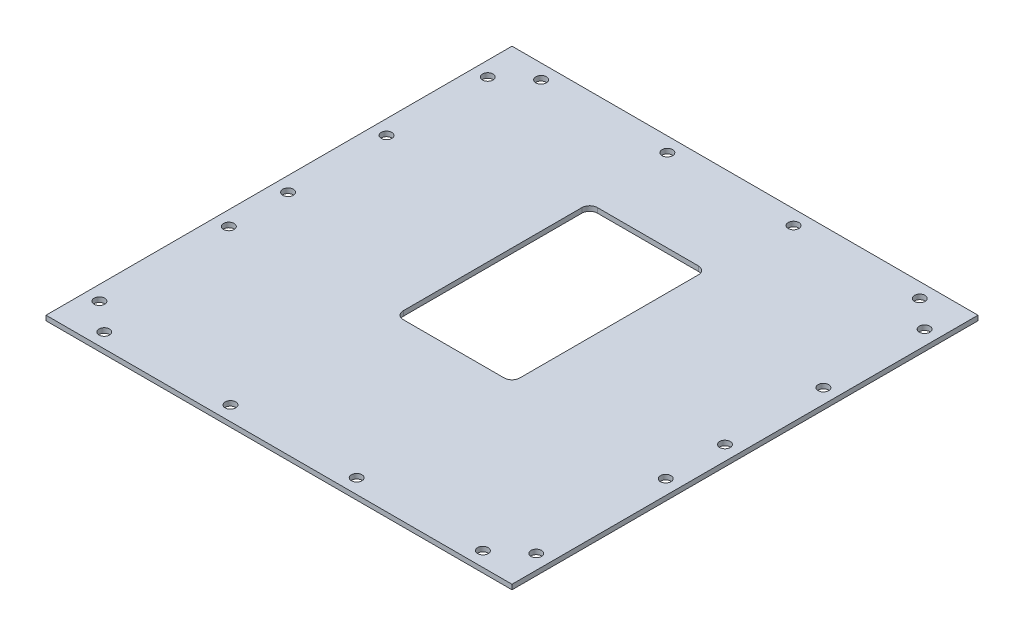
from build123d import *

# Parameters (mm, degrees)
SKETCH2_W                 = 152.4
SKETCH2_H                 = 152.4
BOSS_EXTRUDE1_DEPTH       = 1.5875
F_5_CLEARANCE_HOLE2_D     = 3.4544
F_5_CLEARANCE_HOLE3_D     = 3.4544
LPATTERN1_COUNT           = 4
LPATTERN1_PITCH           = 42.333333333
LPATTERN2_COUNT           = 4
LPATTERN2_PITCH           = 41.275
F_5_CLEARANCE_HOLE4_D     = 3.4544
F_5_CLEARANCE_HOLE4_DEPTH = 12.7
F_5_CLEARANCE_HOLE4_TIP   = 1.037806461
SKETCH12_W                = 38.1
SKETCH12_H                = 63.5
CUT_EXTRUDE1_DEPTH        = 2.54
FILLET2_R                 = 2.54


with BuildPart() as part:
    # Sketch2 → Boss-Extrude1 (new body)
    with BuildSketch(Plane(origin=(0, 0, 0), x_dir=(1, 0, 0), z_dir=(0, 1, 0))):
        with Locations((76.2, 76.2)):
            Rectangle(SKETCH2_W, SKETCH2_H)
    extrude(amount=BOSS_EXTRUDE1_DEPTH)

    # #5 Clearance Hole2 (through all)
    with Locations(Plane(origin=(0, 1.5875, 0), x_dir=(1, 0, 0), z_dir=(0, 1, 0))):
        with Locations((14.2875, 147.6375), (14.2875, 4.7625)):
            f_5_clearance_hole2 = Hole(F_5_CLEARANCE_HOLE2_D / 2)

    # #5 Clearance Hole3 (through all)
    with Locations(Plane(origin=(0, 1.5875, 0), x_dir=(1, 0, 0), z_dir=(0, 1, 0))):
        with Locations((4.7625, 139.7), (147.6375, 139.7)):
            f_5_clearance_hole3 = Hole(F_5_CLEARANCE_HOLE3_D / 2)

    # LPattern1: #5 Clearance Hole3 ×4, 1 skipped
    with Locations(*[(0, 0, i * LPATTERN1_PITCH) for i in range(1, LPATTERN1_COUNT) if i not in (1,)]):
        add(f_5_clearance_hole3, mode=Mode.SUBTRACT)

    # LPattern2: #5 Clearance Hole2 ×4
    with Locations(*[(i * LPATTERN2_PITCH, 0, 0) for i in range(1, LPATTERN2_COUNT)]):
        add(f_5_clearance_hole2, mode=Mode.SUBTRACT)

    # #5 Clearance Hole4
    with Locations(Plane(origin=(0, 1.5875, 0), x_dir=(1, 0, 0), z_dir=(0, 1, 0))):
        with Locations((147.6375, 106.61), (147.6375, 74.4), (4.7625, 74.4), (4.7625, 106.61)):
            Hole(F_5_CLEARANCE_HOLE4_D / 2, depth=F_5_CLEARANCE_HOLE4_DEPTH)
            with Locations((0, 0, -(F_5_CLEARANCE_HOLE4_DEPTH + F_5_CLEARANCE_HOLE4_TIP / 2))):  # 118° drill point
                Cone(0, F_5_CLEARANCE_HOLE4_D / 2, F_5_CLEARANCE_HOLE4_TIP, mode=Mode.SUBTRACT)

    # Sketch12 → Cut-Extrude1 (cut)
    with BuildSketch(Plane(origin=(0, 1.5875, 0), x_dir=(1, 0, 0), z_dir=(0, 1, 0))):
        with Locations((76.2, 88.9)):
            Rectangle(SKETCH12_W, SKETCH12_H)
    extrude(amount=-CUT_EXTRUDE1_DEPTH, mode=Mode.SUBTRACT)

    # Fillet2
    fillet2_edges = [part.edges().sort_by_distance(p)[0] for p in [
        (95.25, 0.79375, -57.15),
        (57.15, 0.79375, -57.15),
        (57.15, 0.79375, -120.65),
        (95.25, 0.79375, -120.65),
    ]]
    fillet(fillet2_edges, radius=FILLET2_R)


solid = part.part
